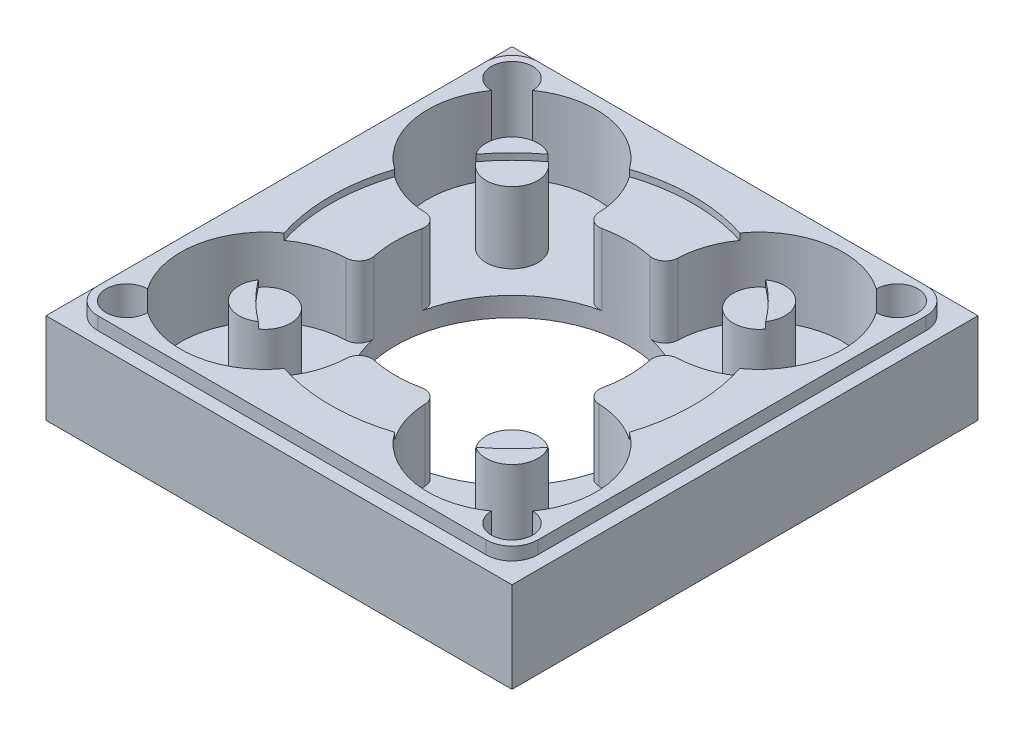
from build123d import *

# Parameters (mm, degrees)
SKETCH1_W           = 57.15
SKETCH1_H           = 57.15
SKETCH1_R           = 14.2875
BOSS_EXTRUDE1_DEPTH = 12.7
SKETCH2_W           = 57.15
SKETCH2_H           = 57.15
CUT_EXTRUDE1_DEPTH  = 1.5875
SKETCH4_R           = 10.31875
SKETCH4_R_2         = 3.175
CUT_EXTRUDE3_DEPTH  = 9.525
SKETCH5_R           = 22.225
CUT_EXTRUDE4_DEPTH  = 0.79375
SKETCH6_R           = 2.54
CUT_EXTRUDE5_DEPTH  = 43.359783404
CUT_EXTRUDE6_START  = -0.79375
SKETCH8_R           = 22.225
CUT_EXTRUDE6_DEPTH  = 0.79375
FILLET1_R           = 1.5875


with BuildPart() as part:
    # Sketch1 → Boss-Extrude1 (new body)
    with BuildSketch(Plane(origin=(0, 0, 0), x_dir=(1, 0, 0), z_dir=(0, 1, 0))):
        Rectangle(SKETCH1_W, SKETCH1_H)
        Circle(SKETCH1_R, mode=Mode.SUBTRACT)
    extrude(amount=BOSS_EXTRUDE1_DEPTH)

    # Sketch2 → Cut-Extrude1 (cut)
    with BuildSketch(Plane(origin=(0, 12.7, 0), x_dir=(1, 0, 0), z_dir=(0, 1, 0))):
        Rectangle(SKETCH2_W, SKETCH2_H)
        with BuildLine():
            Line((-23.8125, -26.9875), (23.8125, -26.9875))
            ThreePointArc((23.8125, -26.9875), (26.05756403, -26.05756403), (26.9875, -23.8125))
            Line((26.9875, -23.8125), (26.9875, 23.8125))
            ThreePointArc((26.9875, 23.8125), (26.05756403, 26.05756403), (23.8125, 26.9875))
            Line((23.8125, 26.9875), (-23.8125, 26.9875))
            ThreePointArc((-23.8125, 26.9875), (-26.05756403, 26.05756403), (-26.9875, 23.8125))
            Line((-26.9875, 23.8125), (-26.9875, -23.8125))
            ThreePointArc((-26.9875, -23.8125), (-26.05756403, -26.05756403), (-23.8125, -26.9875))
        make_face(mode=Mode.SUBTRACT)
    extrude(amount=-CUT_EXTRUDE1_DEPTH, mode=Mode.SUBTRACT)

    # Sketch4 → Cut-Extrude3 (cut)
    # profile 1 of 4: a face of its own
    with BuildSketch(Plane(origin=(0, 12.7, 0), x_dir=(1, 0, 0), z_dir=(0, 1, 0))):
        with Locations((15.154182204, 15.154182204)):
            Circle(SKETCH4_R)
        with Locations((15.154182204, 15.154182204)):
            Circle(SKETCH4_R_2, mode=Mode.SUBTRACT)
    # profile 2 of 4: a face of its own
    with BuildSketch(Plane(origin=(0, 12.7, 0), x_dir=(1, 0, 0), z_dir=(0, 1, 0))):
        with Locations((15.154182204, -15.154182204)):
            Circle(SKETCH4_R)
        with Locations((15.154182204, -15.154182204)):
            Circle(SKETCH4_R_2, mode=Mode.SUBTRACT)
    # profile 3 of 4: a face of its own
    with BuildSketch(Plane(origin=(0, 12.7, 0), x_dir=(1, 0, 0), z_dir=(0, 1, 0))):
        with Locations((-15.154182204, -15.154182204)):
            Circle(SKETCH4_R)
        with Locations((-15.154182204, -15.154182204)):
            Circle(SKETCH4_R_2, mode=Mode.SUBTRACT)
    # profile 4 of 4: a face of its own
    with BuildSketch(Plane(origin=(0, 12.7, 0), x_dir=(1, 0, 0), z_dir=(0, 1, 0))):
        with Locations((-15.154182204, 15.154182204)):
            Circle(SKETCH4_R)
        with Locations((-15.154182204, 15.154182204)):
            Circle(SKETCH4_R_2, mode=Mode.SUBTRACT)
    extrude(amount=-CUT_EXTRUDE3_DEPTH, mode=Mode.SUBTRACT)

    # Sketch5 → Cut-Extrude4 (cut)
    with BuildSketch(Plane(origin=(0, 12.7, 0), x_dir=(1, 0, 0), z_dir=(0, 1, 0))):
        Circle(SKETCH5_R)
    extrude(amount=-CUT_EXTRUDE4_DEPTH, mode=Mode.SUBTRACT)

    # Sketch6 → Cut-Extrude5 (cut, through all)
    with BuildSketch(Plane.XZ):
        with Locations((-23.622, 23.622)):
            Circle(SKETCH6_R)
        with Locations((23.622, 23.622)):
            Circle(SKETCH6_R)
        with Locations((23.622, -23.622)):
            Circle(SKETCH6_R)
        with Locations((-23.622, -23.622)):
            Circle(SKETCH6_R)
    extrude(amount=-CUT_EXTRUDE5_DEPTH, mode=Mode.SUBTRACT)

    # Sketch8 → Cut-Extrude6 (cut)
    with BuildSketch(Plane.XZ.offset(CUT_EXTRUDE6_START)):
        Circle(SKETCH8_R)
    extrude(amount=CUT_EXTRUDE6_DEPTH, mode=Mode.SUBTRACT)

    # Fillet1
    fillet1_edges = [part.edges().sort_by_distance(p)[0] for p in [
        (4.987590699, 7.540625, -13.388674142),
        (-4.987590699, 7.540625, -13.388674142),
        (-13.388674142, 7.540625, -4.987590699),
        (-13.388674142, 7.540625, 4.987590699),
        (-4.987590699, 7.540625, 13.388674142),
        (4.987590699, 7.540625, 13.388674142),
        (13.388674142, 7.540625, 4.987590699),
        (13.388674142, 7.540625, -4.987590699),
    ]]
    fillet(fillet1_edges, radius=FILLET1_R)


solid = part.part
